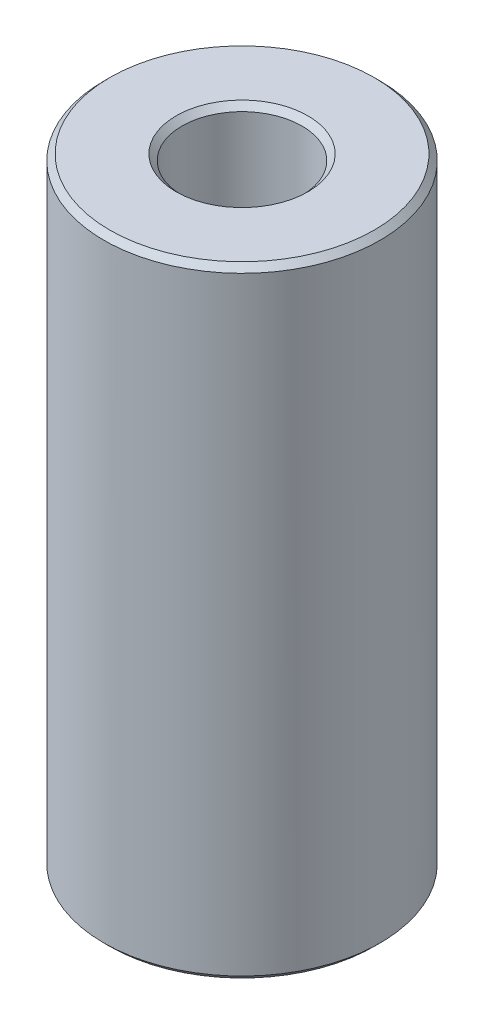
from build123d import *

# Parameters (mm, degrees)
SKETCH1_R           = 57.5
BOSS_EXTRUDE1_DEPTH = 258.338370243
SKETCH2_R           = 24.987664596
CUT_EXTRUDE1_DEPTH  = 271.834291662
CHAMFER1_SIZE       = 2.451215268


with BuildPart() as part:
    # Sketch1 → Boss-Extrude1 (new body)
    with BuildSketch(Plane(origin=(0, 0, 0), x_dir=(1, 0, 0), z_dir=(0, 1, 0))):
        Circle(SKETCH1_R)
    extrude(amount=BOSS_EXTRUDE1_DEPTH)

    # Sketch2 → Cut-Extrude1 (cut, through all)
    with BuildSketch(Plane(origin=(0, 0, 0), x_dir=(1, 0, 0), z_dir=(0, 1, 0))):
        Circle(SKETCH2_R)
    extrude(amount=CUT_EXTRUDE1_DEPTH, mode=Mode.SUBTRACT)

    # Chamfer1
    chamfer1_edges = [part.edges().sort_by_distance(p)[0] for p in [
        (-24.987664596, 258.338370243, 0),
        (-24.987664596, 0, 0),
        (-57.5, 0, 0),
        (-57.5, 258.338370243, 0),
    ]]
    chamfer(chamfer1_edges, length=CHAMFER1_SIZE)


solid = part.part
